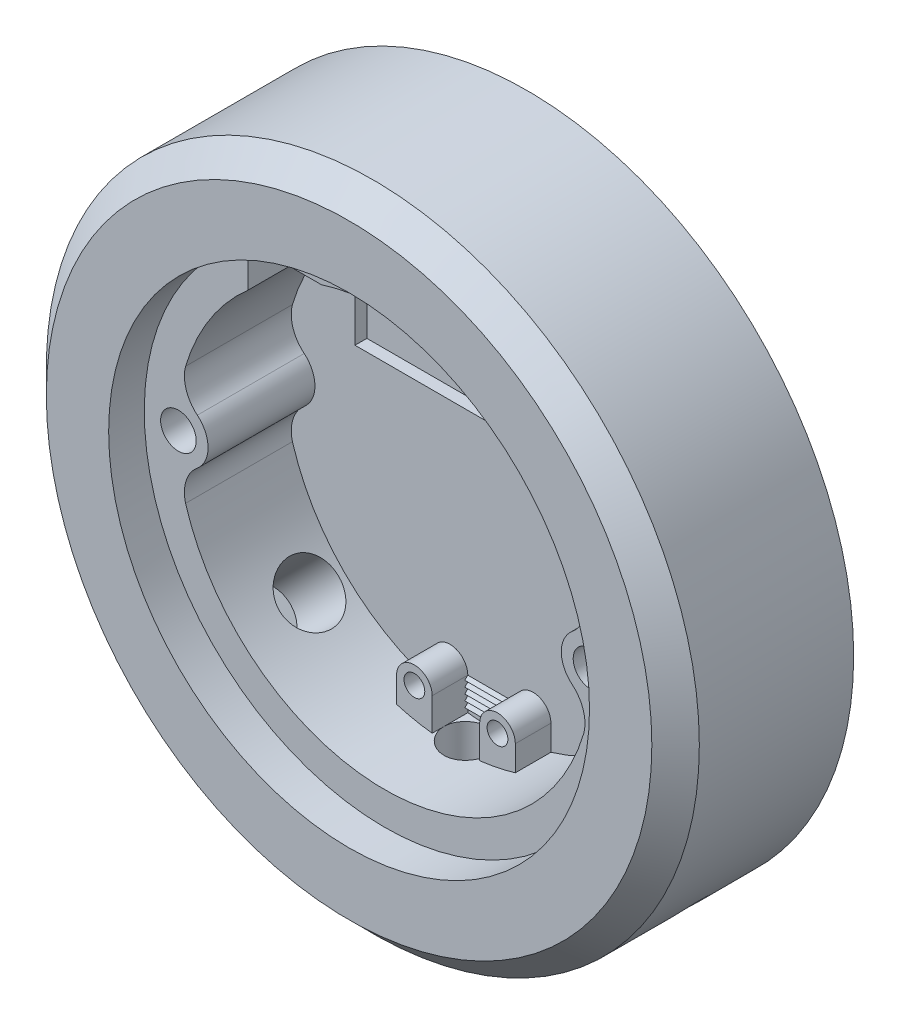
from build123d import *

# Parameters (mm, degrees)
SKETCH1_R                = 27.5
BOSS_EXTRUDE1_DEPTH      = 15
CHAMFER1_SIZE            = 2
SKETCH2_R                = 17.5
CUT_EXTRUDE1_DEPTH       = 12
SKETCH3_R                = 20.25
CUT_EXTRUDE2_DEPTH       = 3
SKETCH4_R                = 2
CUT_EXTRUDE3_DEPTH       = 42.683330001
BOSS_EXTRUDE2_DEPTH      = 9
SKETCH6_R                = 1.5
CUT_EXTRUDE4_DEPTH       = 41.700123015
CHAMFER2_SIZE            = 2
CHAMFER2_OF_MIRROR1_SIZE = 2
BOSS_EXTRUDE8_START      = 3
BOSS_EXTRUDE8_DEPTH      = 3
SKETCH14_W               = 23
SKETCH14_H               = 12
CUT_EXTRUDE5_DEPTH       = 10
SKETCH16_R               = 1.5
CUT_EXTRUDE6_DEPTH       = 10
SKETCH17_R               = 2.5
CUT_EXTRUDE7_DEPTH       = 6
SKETCH18_R               = 0.875
CUT_EXTRUDE8_DEPTH       = 3
CHAMFER3_SIZE            = 0.8
SKETCH19_W               = 4
SKETCH19_H               = 0.5
BOSS_EXTRUDE9_DEPTH      = 0.5
CHAMFER4_SIZE            = 0.5
LPATTERN1_START          = -8.942375138
LPATTERN1_OUTLINE_W      = 6
LPATTERN1_OUTLINE_H      = 2.185015825
LPATTERN1_DEPTH          = 0.353553391
LPATTERN1_START_2        = -9.649481919
LPATTERN1_2_OUTLINE_W    = 6
LPATTERN1_2_OUTLINE_H    = 0.353553391
LPATTERN1_2_DEPTH        = 0.353553391
LPATTERN1_START_3        = -10.003035309
LPATTERN1_3_OUTLINE_W    = 6
LPATTERN1_3_OUTLINE_H    = 0.353553391
LPATTERN1_3_DEPTH        = 0.35355339
LPATTERN1_START_4        = -9.295928528
LPATTERN1_4_OUTLINE_W    = 6
LPATTERN1_4_OUTLINE_H    = 0.35355339
LPATTERN1_4_DEPTH        = 0.35355339


# Read off the part's stored shape, not the designer's step: LPattern1
with BuildPart() as part:
    # Sketch1 → Boss-Extrude1 (new body)
    with BuildSketch(Plane.XY):
        Circle(SKETCH1_R)
    extrude(amount=BOSS_EXTRUDE1_DEPTH)

    # Chamfer1
    chamfer1_edges = [part.edges().sort_by_distance(p)[0] for p in [
        (-27.5, 0, 15),
    ]]
    chamfer(chamfer1_edges, length=CHAMFER1_SIZE)

    # Sketch2 → Cut-Extrude1 (cut)
    with BuildSketch(Plane.XY.offset(15)):
        Circle(SKETCH2_R)
    extrude(amount=-CUT_EXTRUDE1_DEPTH, mode=Mode.SUBTRACT)

    # Sketch3 → Cut-Extrude2 (cut)
    with BuildSketch(Plane.XY.offset(15)):
        Circle(SKETCH3_R)
    extrude(amount=-CUT_EXTRUDE2_DEPTH, mode=Mode.SUBTRACT)

    # Sketch4 → Cut-Extrude3 (cut, through all)
    with BuildSketch(Plane(origin=(0, 0, 0), x_dir=(1, 0, 0), z_dir=(0, 1, 0))):
        with Locations(Location((0, -5, 0), (0, 0, 270))):
            Circle(SKETCH4_R)
    extrude(amount=-CUT_EXTRUDE3_DEPTH, mode=Mode.SUBTRACT)

    # Sketch5 → Boss-Extrude2 (add)
    with BuildSketch(Plane.XY.offset(12)):
        with BuildLine():
            ThreePointArc((-15.781356255, -1.926213803), (-14.875, 0), (-15.781356255, 1.926213803))
            ThreePointArc((-15.781356255, 1.926213803), (-16.724757779, 3.318673761), (-16.770509831, 5))
            ThreePointArc((-16.770509831, 5), (-17.5, 0), (-16.770509831, -5))
            ThreePointArc((-16.770509831, -5), (-16.724757779, -3.318673761), (-15.781356255, -1.926213803))
        make_face()
    boss_extrude2 = extrude(amount=-BOSS_EXTRUDE2_DEPTH)

    # Sketch6 → Cut-Extrude4 (cut, through all)
    with BuildSketch(Plane.XY.offset(12)):
        with Locations((-17.375, 0)):
            Circle(SKETCH6_R)
    cut_extrude4 = extrude(amount=-CUT_EXTRUDE4_DEPTH, mode=Mode.SUBTRACT)

    # Chamfer2
    chamfer2_edges = [part.edges().sort_by_distance(p)[0] for p in [
        (-18.875, 0, 0),
    ]]
    chamfer(chamfer2_edges, length=CHAMFER2_SIZE)

    # Mirror1: Boss-Extrude2, Cut-Extrude4 across plane
    add(boss_extrude2.mirror(Plane(origin=(0, 0, 0), x_dir=(0, 0, 1), z_dir=(1, 0, 0))))
    add(cut_extrude4.mirror(Plane(origin=(0, 0, 0), x_dir=(0, 0, 1), z_dir=(1, 0, 0))), mode=Mode.SUBTRACT)

    # Chamfer2 of Mirror1
    chamfer2_of_mirror1_edges = [part.edges().sort_by_distance(p)[0] for p in [
        (18.875, 0, 0),
    ]]
    chamfer(chamfer2_of_mirror1_edges, length=CHAMFER2_OF_MIRROR1_SIZE)

    # Sketch8 → Boss-Extrude8 (add)
    with BuildSketch(Plane.XY.offset(3).offset(BOSS_EXTRUDE8_START)):
        with BuildLine():
            Line((-2, -17.385338651), (-2, -14.646428199))
            ThreePointArc((-2, -14.646428199), (-3.5, -13.146428199), (-5, -14.646428199))
            Line((-5, -14.646428199), (-5, -16.770509831))
            ThreePointArc((-5, -16.770509831), (-3.513474579, -17.143672196), (-2, -17.385338651))
        make_face()
    boss_extrude8 = extrude(amount=-BOSS_EXTRUDE8_DEPTH)

    # Sketch14 → Cut-Extrude5 (cut)
    with BuildSketch(Plane.XY.offset(12)):
        with Locations((0, 10.667708301)):
            Rectangle(SKETCH14_W, SKETCH14_H)
    extrude(amount=-CUT_EXTRUDE5_DEPTH, mode=Mode.SUBTRACT)

    # Sketch16 → Cut-Extrude6 (cut, symmetric)
    with BuildSketch(Plane(origin=(14.318912319, -14.318912319, 3), x_dir=(0, 0, -1), z_dir=(0.7071067811865489, -0.7071067811865462, 0))):
        with Locations(Location((-3, 0, 0), (0, 0, 270))):
            Circle(SKETCH16_R)
    cut_extrude6 = extrude(amount=CUT_EXTRUDE6_DEPTH, both=True, mode=Mode.SUBTRACT)

    # Sketch17 → Cut-Extrude7 (cut)
    with BuildSketch(Plane(origin=(12.197591975, -12.197591975, 3), x_dir=(0, 0, -1), z_dir=(0.7071067811865489, -0.7071067811865462, 0))):
        with Locations(Location((-3, 0, 0), (0, 0, 270))):
            Circle(SKETCH17_R)
    cut_extrude7 = extrude(amount=CUT_EXTRUDE7_DEPTH, mode=Mode.SUBTRACT)

    # Mirror2: Cut-Extrude6, Cut-Extrude7 across plane
    add(cut_extrude6.mirror(Plane(origin=(0, 0, 0), x_dir=(0, 0, 1), z_dir=(1, 0, 0))), mode=Mode.SUBTRACT)
    add(cut_extrude7.mirror(Plane(origin=(0, 0, 0), x_dir=(0, 0, 1), z_dir=(1, 0, 0))), mode=Mode.SUBTRACT)

    # Sketch18 → Cut-Extrude8 (cut)
    with BuildSketch(Plane.XY.offset(6)):
        with Locations((-3.5, -14.646428199)):
            Circle(SKETCH18_R)
    cut_extrude8 = extrude(amount=-CUT_EXTRUDE8_DEPTH, mode=Mode.SUBTRACT)

    # Mirror5: Boss-Extrude8, Cut-Extrude8 across plane
    add(boss_extrude8.mirror(Plane(origin=(0, 0, 0), x_dir=(0, 0, 1), z_dir=(1, 0, 0))))
    add(cut_extrude8.mirror(Plane(origin=(0, 0, 0), x_dir=(0, 0, 1), z_dir=(1, 0, 0))), mode=Mode.SUBTRACT)

    # Chamfer3
    chamfer3_edges = [part.edges().sort_by_distance(p)[0] for p in [
        (-4.375, -14.646428199, 3),
        (4.375, -14.646428199, 3),
    ]]
    chamfer(chamfer3_edges, length=CHAMFER3_SIZE)

    # Sketch19 → Boss-Extrude9 (add)
    with BuildSketch(Plane.XY.offset(3)):
        with Locations((0, -14.896428199)):
            Rectangle(SKETCH19_W, SKETCH19_H)
    extrude(amount=BOSS_EXTRUDE9_DEPTH)

    # Chamfer4
    # the kernel refuses this chamfer: 0.5 mm, written as the material it takes off along each edge
    with BuildSketch(Plane(origin=(-2, -15.146428199, 3.5), x_dir=(0, -0.027495876610585623, -0.9996219169112968), z_dir=(1, 0, 0))) as chamfer4_piece_1:
        Polygon((CHAMFER4_SIZE * 0.999621916911, CHAMFER4_SIZE * 0.0274958766106), (-CHAMFER4_SIZE * 0.0274958766106, CHAMFER4_SIZE * 0.999621916911), (0, 0), align=None)
    extrude(amount=4, mode=Mode.SUBTRACT)
    with BuildSketch(Plane(origin=(2, -14.646428199, 3.5), x_dir=(0, -0.9996219169112968, 0.02749587661058651), z_dir=(-1, 0, 0))) as chamfer4_piece_2:
        Polygon((CHAMFER4_SIZE * 0.999621916911, -CHAMFER4_SIZE * 0.0274958766106), (-CHAMFER4_SIZE * 0.0274958766106, -CHAMFER4_SIZE * 0.999621916911), (0, 0), align=None)
    extrude(amount=4, mode=Mode.SUBTRACT)

    # LPattern1 outline → LPattern1 (add)
    with BuildSketch(Plane(origin=(0, 0, 0), x_dir=(1, 0, 0), z_dir=(0, 0.7071067811865476, 0.7071067811865476)).offset(LPATTERN1_START)):
        with Locations((0, -12.092507913)):
            Rectangle(LPATTERN1_OUTLINE_W, LPATTERN1_OUTLINE_H)
    extrude(amount=LPATTERN1_DEPTH)

    # LPattern1 2 outline → LPattern1 2 (add)
    with BuildSketch(Plane(origin=(0, 0, 0), x_dir=(1, 0, 0), z_dir=(0, 0.7071067811865476, 0.7071067811865476)).offset(LPATTERN1_START_2)):
        with Locations((0, -13.715345911)):
            Rectangle(LPATTERN1_2_OUTLINE_W, LPATTERN1_2_OUTLINE_H)
    extrude(amount=LPATTERN1_2_DEPTH)

    # LPattern1 3 outline → LPattern1 3 (add)
    with BuildSketch(Plane(origin=(0, 0, 0), x_dir=(1, 0, 0), z_dir=(0, 0.7071067811865476, 0.7071067811865476)).offset(LPATTERN1_START_3)):
        with Locations((0, -14.068899302)):
            Rectangle(LPATTERN1_3_OUTLINE_W, LPATTERN1_3_OUTLINE_H)
    extrude(amount=LPATTERN1_3_DEPTH)

    # LPattern1 4 outline → LPattern1 4 (add)
    with BuildSketch(Plane(origin=(0, 0, 0), x_dir=(1, 0, 0), z_dir=(0, 0.7071067811865476, 0.7071067811865476)).offset(LPATTERN1_START_4)):
        with Locations((0, -13.36179252)):
            Rectangle(LPATTERN1_4_OUTLINE_W, LPATTERN1_4_OUTLINE_H)
    extrude(amount=LPATTERN1_4_DEPTH)


solid = part.part
